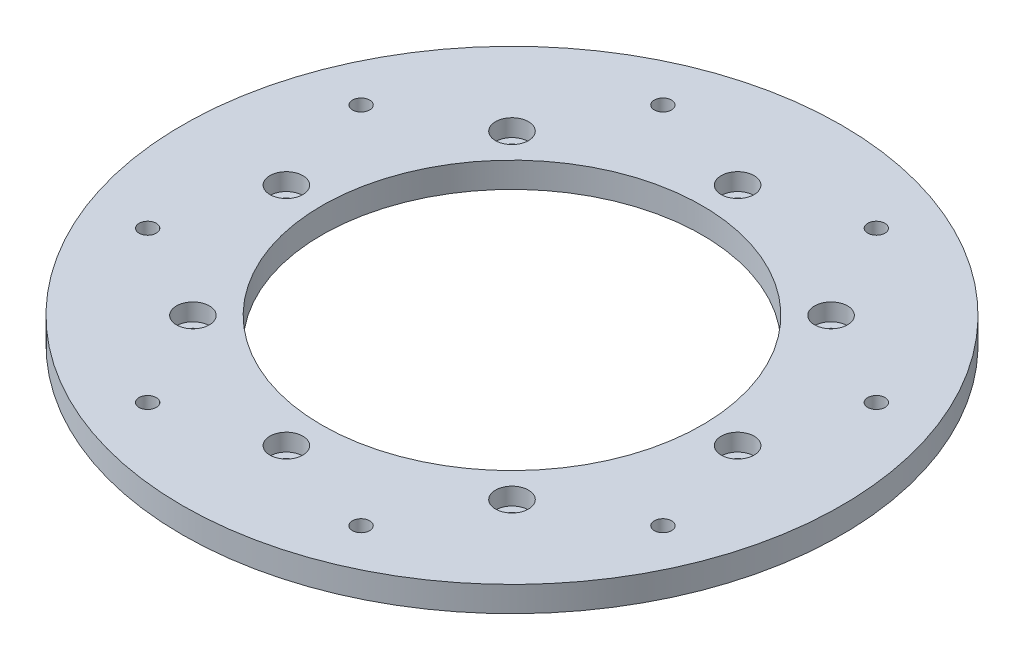
from build123d import *

# Parameters (mm, degrees)
SKETCH1_R                                           = 65
SKETCH1_R_2                                         = 37.5
BOSS_EXTRUDE1_DEPTH                                 = 5
CBORE_FOR_M3_HEX_SOCKET_HEAD_CAP_SCREW1_D           = 3.4
CBORE_FOR_M3_HEX_SOCKET_HEAD_CAP_SCREW1_CBORE_D     = 6.5
CBORE_FOR_M3_HEX_SOCKET_HEAD_CAP_SCREW1_CBORE_DEPTH = 3.4
M3_CLEARANCE_HOLE1_D                                = 3.4


with BuildPart() as part:
    # Sketch1 → Boss-Extrude1 (new body)
    with BuildSketch(Plane(origin=(0, 0, 0), x_dir=(1, 0, 0), z_dir=(0, 1, 0))):
        Circle(SKETCH1_R)
        Circle(SKETCH1_R_2, mode=Mode.SUBTRACT)
    extrude(amount=BOSS_EXTRUDE1_DEPTH)

    # CBORE for M3 Hex Socket Head Cap Screw1 (through all)
    with Locations(Plane(origin=(0, 5, 0), x_dir=(1, 0, 0), z_dir=(0, 1, 0))):
        with Locations((-31.466251763, 31.466251763), (0, 44.5), (31.466251763, 31.466251763), (44.5, 0), (31.466251763, -31.466251763), (0, -44.5), (-31.466251763, -31.466251763), (-44.5, 0)):
            CounterBoreHole(CBORE_FOR_M3_HEX_SOCKET_HEAD_CAP_SCREW1_D / 2, CBORE_FOR_M3_HEX_SOCKET_HEAD_CAP_SCREW1_CBORE_D / 2, CBORE_FOR_M3_HEX_SOCKET_HEAD_CAP_SCREW1_CBORE_DEPTH)

    # M3 Clearance Hole1 (through all)
    with Locations(Plane(origin=(0, 0, 0), x_dir=(-1, 0, 0), z_dir=(0, -1, 0))):
        with Locations((-50.813374288, -21.04758878), (-50.813374288, 21.04758878), (-21.04758878, 50.813374288), (21.04758878, 50.813374288), (50.813374288, 21.04758878), (50.813374288, -21.04758878), (21.04758878, -50.813374288), (-21.04758878, -50.813374288)):
            Hole(M3_CLEARANCE_HOLE1_D / 2)


solid = part.part
